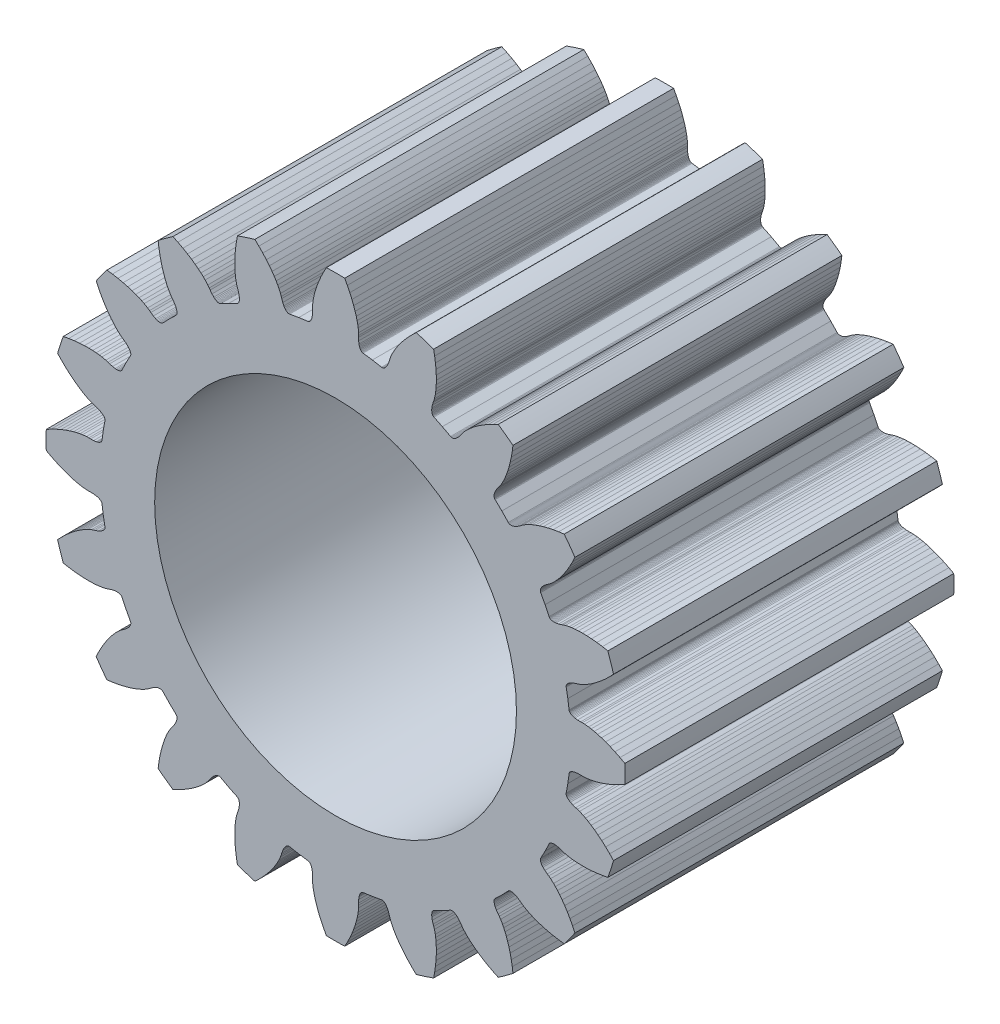
from build123d import *

# Parameters (mm, degrees)
MODEL_R             = 5.5
BOSS_EXTRUDE1_DEPTH = 10


with BuildPart() as part:
    # Model → Boss-Extrude1 (new body)
    with BuildSketch(Plane.XY):
        with BuildLine():
            Line((8.2121244, 2.2123672), (8.3351722, 2.3318876))
            Line((8.3351722, 2.3318876), (8.450961336, 2.453780018))
            ThreePointArc((8.450961336, 2.453780018), (8.369285341, 2.719345705), (8.279267036, 2.982200812))
            Line((8.279267036, 2.982200812), (8.1139451, 3.0127546))
            Line((8.1139451, 3.0127546), (7.944145, 3.037123))
            Line((7.944145, 3.037123), (7.7837495, 3.0533203))
            Line((7.7837495, 3.0533203), (7.6379915, 3.0618918))
            Line((7.6379915, 3.0618918), (7.5028672, 3.0641531))
            Line((7.5028672, 3.0641531), (7.3833956, 3.0611352))
            Line((7.3833956, 3.0611352), (7.2776713, 3.054067))
            Line((7.2776713, 3.054067), (7.1825669, 3.0436894))
            Line((7.1825669, 3.0436894), (7.1037669, 3.0317316))
            Line((7.1037669, 3.0317316), (6.9853901, 3.0064547))
            Line((6.9853901, 3.0064547), (6.9168974, 2.9858319))
            Line((6.9168974, 2.9858319), (6.8682247, 2.9676986))
            Line((6.8682247, 2.9676986), (6.7797007, 2.9411903))
            Line((6.7797007, 2.9411903), (6.7013706, 2.9268345))
            Line((6.7013706, 2.9268345), (6.6662943, 2.923934))
            Line((6.6662943, 2.923934), (6.6340777, 2.9237252))
            Line((6.6340777, 2.9237252), (6.6048156, 2.9260881))
            Line((6.6048156, 2.9260881), (6.5785985, 2.930889))
            Line((6.5785985, 2.930889), (6.5555257, 2.9380215))
            Line((6.5555257, 2.9380215), (6.5356652, 2.9473296))
            Line((6.5356652, 2.9473296), (6.5191075, 2.9587021))
            Line((6.5191075, 2.9587021), (6.5059252, 2.9719965))
            Line((6.5059252, 2.9719965), (6.4943089, 2.9910943))
            Line((6.4943089, 2.9910943), (6.3706966, 3.2460321))
            Line((6.3706966, 3.2460321), (6.2371051, 3.4958851))
            Line((6.2371051, 3.4958851), (6.2284826, 3.5165084))
            Line((6.2284826, 3.5165084), (6.2254756, 3.5349873))
            Line((6.2254756, 3.5349873), (6.2260074, 3.5550674))
            Line((6.2260074, 3.5550674), (6.2301507, 3.5766059))
            Line((6.2301507, 3.5766059), (6.2379422, 3.5994647))
            Line((6.2379422, 3.5994647), (6.2494682, 3.6234967))
            Line((6.2494682, 3.6234967), (6.2647564, 3.648559))
            Line((6.2647564, 3.648559), (6.2838618, 3.6745001))
            Line((6.2838618, 3.6745001), (6.3068257, 3.7011726))
            Line((6.3068257, 3.7011726), (6.364481, 3.7561048))
            Line((6.364481, 3.7561048), (6.4379598, 3.8121411))
            Line((6.4379598, 3.8121411), (6.481239, 3.8408596))
            Line((6.481239, 3.8408596), (6.5381822, 3.8841496))
            Line((6.5381822, 3.8841496), (6.6282118, 3.965061))
            Line((6.6282118, 3.965061), (6.6842033, 4.0217829))
            Line((6.6842033, 4.0217829), (6.7485, 4.0926242))
            Line((6.7485, 4.0926242), (6.8163615, 4.1740024))
            Line((6.8163615, 4.1740024), (6.8890266, 4.268883))
            Line((6.8890266, 4.268883), (6.9666212, 4.3795301))
            Line((6.9666212, 4.3795301), (7.0453612, 4.502489))
            Line((7.0453612, 4.502489), (7.1265354, 4.6417722))
            Line((7.1265354, 4.6417722), (7.2066269, 4.7934668))
            Line((7.2066269, 4.7934668), (7.27908211, 4.945174101))
            ThreePointArc((7.27908211, 4.945174101), (7.119339371, 5.17250287), (6.952500105, 5.39467571))
            Line((6.952500105, 5.39467571), (6.785828, 5.3726468))
            Line((6.785828, 5.3726468), (6.6168083, 5.3433514))
            Line((6.6168083, 5.3433514), (6.4592578, 5.3091911))
            Line((6.4592578, 5.3091911), (6.3179849, 5.2723013))
            Line((6.3179849, 5.2723013), (6.1887753, 5.2326962))
            Line((6.1887753, 5.2326962), (6.0760837, 5.1929073))
            Line((6.0760837, 5.1929073), (5.9777181, 5.1535144))
            Line((5.9777181, 5.1535144), (5.8904753, 5.1142559))
            Line((5.8904753, 5.1142559), (5.8192272, 5.0785328))
            Line((5.8192272, 5.0785328), (5.7144552, 5.0179126))
            Line((5.7144552, 5.0179126), (5.6556875, 4.9771337))
            Line((5.6556875, 4.9771337), (5.6150006, 4.9448472))
            Line((5.6150006, 4.9448472), (5.5390008, 4.8922809))
            Line((5.5390008, 4.8922809), (5.4689406, 4.8544224))
            Line((5.4689406, 4.8544224), (5.4364774, 4.8408247))
            Line((5.4364774, 4.8408247), (5.4059021, 4.8306707))
            Line((5.4059021, 4.8306707), (5.377342, 4.8238754))
            Line((5.377342, 4.8238754), (5.3509245, 4.8203399))
            Line((5.3509245, 4.8203399), (5.3267768, 4.8199934))
            Line((5.3267768, 4.8199934), (5.3050121, 4.8227087))
            Line((5.3050121, 4.8227087), (5.2857505, 4.8284079))
            Line((5.2857505, 4.8284079), (5.2691052, 4.8369781))
            Line((5.2691052, 4.8369781), (5.2521558, 4.8515515))
            Line((5.2521558, 4.8515515), (5.0558135, 5.0558135))
            Line((5.0558135, 5.0558135), (4.8515515, 5.2521558))
            Line((4.8515515, 5.2521558), (4.8369781, 5.2691052))
            Line((4.8369781, 5.2691052), (4.8284079, 5.2857505))
            Line((4.8284079, 5.2857505), (4.8227087, 5.3050121))
            Line((4.8227087, 5.3050121), (4.8199934, 5.3267768))
            Line((4.8199934, 5.3267768), (4.8203399, 5.3509245))
            Line((4.8203399, 5.3509245), (4.8238754, 5.377342))
            Line((4.8238754, 5.377342), (4.8306707, 5.4059021))
            Line((4.8306707, 5.4059021), (4.8408247, 5.4364774))
            Line((4.8408247, 5.4364774), (4.8544224, 5.4689406))
            Line((4.8544224, 5.4689406), (4.8922809, 5.5390008))
            Line((4.8922809, 5.5390008), (4.9448472, 5.6150006))
            Line((4.9448472, 5.6150006), (4.9771337, 5.6556875))
            Line((4.9771337, 5.6556875), (5.0179126, 5.7144552))
            Line((5.0179126, 5.7144552), (5.0785328, 5.8192272))
            Line((5.0785328, 5.8192272), (5.1142559, 5.8904753))
            Line((5.1142559, 5.8904753), (5.1535144, 5.9777181))
            Line((5.1535144, 5.9777181), (5.1929073, 6.0760837))
            Line((5.1929073, 6.0760837), (5.2326962, 6.1887753))
            Line((5.2326962, 6.1887753), (5.2723013, 6.3179849))
            Line((5.2723013, 6.3179849), (5.3091911, 6.4592578))
            Line((5.3091911, 6.4592578), (5.3433514, 6.6168083))
            Line((5.3433514, 6.6168083), (5.3726468, 6.785828))
            Line((5.3726468, 6.785828), (5.39467561, 6.952500105))
            ThreePointArc((5.39467561, 6.952500105), (5.172502846, 7.119339476), (4.945174001, 7.27908211))
            Line((4.945174001, 7.27908211), (4.7934668, 7.2066269))
            Line((4.7934668, 7.2066269), (4.6417722, 7.1265354))
            Line((4.6417722, 7.1265354), (4.502489, 7.0453612))
            Line((4.502489, 7.0453612), (4.3795301, 6.9666212))
            Line((4.3795301, 6.9666212), (4.268883, 6.8890266))
            Line((4.268883, 6.8890266), (4.1740024, 6.8163615))
            Line((4.1740024, 6.8163615), (4.0926242, 6.7485))
            Line((4.0926242, 6.7485), (4.0217829, 6.6842033))
            Line((4.0217829, 6.6842033), (3.965061, 6.6282118))
            Line((3.965061, 6.6282118), (3.8841496, 6.5381822))
            Line((3.8841496, 6.5381822), (3.8408596, 6.481239))
            Line((3.8408596, 6.481239), (3.8121411, 6.4379598))
            Line((3.8121411, 6.4379598), (3.7561048, 6.364481))
            Line((3.7561048, 6.364481), (3.7011726, 6.3068257))
            Line((3.7011726, 6.3068257), (3.6745001, 6.2838618))
            Line((3.6745001, 6.2838618), (3.648559, 6.2647564))
            Line((3.648559, 6.2647564), (3.6234967, 6.2494682))
            Line((3.6234967, 6.2494682), (3.5994647, 6.2379422))
            Line((3.5994647, 6.2379422), (3.5766059, 6.2301507))
            Line((3.5766059, 6.2301507), (3.5550674, 6.2260074))
            Line((3.5550674, 6.2260074), (3.5349873, 6.2254756))
            Line((3.5349873, 6.2254756), (3.5165084, 6.2284826))
            Line((3.5165084, 6.2284826), (3.4958851, 6.2371051))
            Line((3.4958851, 6.2371051), (3.2460321, 6.3706966))
            Line((3.2460321, 6.3706966), (2.9910943, 6.4943089))
            Line((2.9910943, 6.4943089), (2.9719965, 6.5059252))
            Line((2.9719965, 6.5059252), (2.9587021, 6.5191075))
            Line((2.9587021, 6.5191075), (2.9473296, 6.5356652))
            Line((2.9473296, 6.5356652), (2.9380215, 6.5555257))
            Line((2.9380215, 6.5555257), (2.930889, 6.5785985))
            Line((2.930889, 6.5785985), (2.9260881, 6.6048156))
            Line((2.9260881, 6.6048156), (2.9237252, 6.6340777))
            Line((2.9237252, 6.6340777), (2.923934, 6.6662943))
            Line((2.923934, 6.6662943), (2.9268345, 6.7013706))
            Line((2.9268345, 6.7013706), (2.9411903, 6.7797007))
            Line((2.9411903, 6.7797007), (2.9676986, 6.8682247))
            Line((2.9676986, 6.8682247), (2.9858319, 6.9168974))
            Line((2.9858319, 6.9168974), (3.0064547, 6.9853901))
            Line((3.0064547, 6.9853901), (3.0317316, 7.1037669))
            Line((3.0317316, 7.1037669), (3.0436894, 7.1825669))
            Line((3.0436894, 7.1825669), (3.054067, 7.2776713))
            Line((3.054067, 7.2776713), (3.0611352, 7.3833956))
            Line((3.0611352, 7.3833956), (3.0641531, 7.5028672))
            Line((3.0641531, 7.5028672), (3.0618918, 7.6379915))
            Line((3.0618918, 7.6379915), (3.0533203, 7.7837495))
            Line((3.0533203, 7.7837495), (3.037123, 7.944145))
            Line((3.037123, 7.944145), (3.0127546, 8.1139451))
            Line((3.0127546, 8.1139451), (2.982200712, 8.279267036))
            ThreePointArc((2.982200712, 8.279267036), (2.719345707, 8.369285655), (2.453779918, 8.450961336))
            Line((2.453779918, 8.450961336), (2.3318876, 8.3351722))
            Line((2.3318876, 8.3351722), (2.2123672, 8.2121244))
            Line((2.2123672, 8.2121244), (2.1049851, 8.0918823))
            Line((2.1049851, 8.0918823), (2.0123762, 7.9789997))
            Line((2.0123762, 7.9789997), (1.9311227, 7.8710111))
            Line((1.9311227, 7.8710111), (1.8633406, 7.7725827))
            Line((1.8633406, 7.7725827), (1.8069157, 7.6828953))
            Line((1.8069157, 7.6828953), (1.7594104, 7.5998544))
            Line((1.7594104, 7.5998544), (1.722767, 7.5290753))
            Line((1.722767, 7.5290753), (1.6736363, 7.418449))
            Line((1.6736363, 7.418449), (1.6500615, 7.3509155))
            Line((1.6500615, 7.3509155), (1.6361226, 7.30088))
            Line((1.6361226, 7.30088), (1.6055352, 7.2136814))
            Line((1.6055352, 7.2136814), (1.571108, 7.1418729))
            Line((1.571108, 7.1418729), (1.5528372, 7.1117907))
            Line((1.5528372, 7.1117907), (1.5340696, 7.0856042))
            Line((1.5340696, 7.0856042), (1.5149583, 7.0633195))
            Line((1.5149583, 7.0633195), (1.4956642, 7.0449314))
            Line((1.4956642, 7.0449314), (1.4763319, 7.0304574))
            Line((1.4763319, 7.0304574), (1.4571279, 7.0198611))
            Line((1.4571279, 7.0198611), (1.438195, 7.0131503))
            Line((1.438195, 7.0131503), (1.4196913, 7.0102998))
            Line((1.4196913, 7.0102998), (1.3974129, 7.0121274))
            Line((1.3974129, 7.0121274), (1.1185064, 7.0619716))
            Line((1.1185064, 7.0619716), (0.8378479, 7.1007538))
            Line((0.8378479, 7.1007538), (0.8160952, 7.1059))
            Line((0.8160952, 7.1059), (0.7993779, 7.1143289))
            Line((0.7993779, 7.1143289), (0.7834454, 7.1265619))
            Line((0.7834454, 7.1265619), (0.7684557, 7.142574))
            Line((0.7684557, 7.142574), (0.7545424, 7.1623135))
            Line((0.7545424, 7.1623135), (0.7418748, 7.1857639))
            Line((0.7418748, 7.1857639), (0.7305852, 7.2128636))
            Line((0.7305852, 7.2128636), (0.7208283, 7.243568))
            Line((0.7208283, 7.243568), (0.7127476, 7.2778238))
            Line((0.7127476, 7.2778238), (0.7021954, 7.3567563))
            Line((0.7021954, 7.3567563), (0.7000509, 7.4491392))
            Line((0.7000509, 7.4491392), (0.702256, 7.5010331))
            Line((0.702256, 7.5010331), (0.7007041, 7.5725463))
            Line((0.7007041, 7.5725463), (0.6881634, 7.6929404))
            Line((0.6881634, 7.6929404), (0.6751854, 7.7715788))
            Line((0.6751854, 7.7715788), (0.6556662, 7.8652353))
            Line((0.6556662, 7.8652353), (0.6297179, 7.9679693))
            Line((0.6297179, 7.9679693), (0.5956693, 8.0825261))
            Line((0.5956693, 8.0825261), (0.551763, 8.2103381))
            Line((0.551763, 8.2103381), (0.4985693, 8.3463135))
            Line((0.4985693, 8.3463135), (0.4335998, 8.4938535))
            Line((0.4335998, 8.4938535), (0.357953, 8.6478127))
            Line((0.357953, 8.6478127), (0.277807302, 8.795601456))
            ThreePointArc((0.277807302, 8.795601456), (0, 8.799987383), (-0.277807302, 8.795601456))
            Line((-0.277807302, 8.795601456), (-0.357953, 8.6478127))
            Line((-0.357953, 8.6478127), (-0.4335998, 8.4938535))
            Line((-0.4335998, 8.4938535), (-0.4985693, 8.3463135))
            Line((-0.4985693, 8.3463135), (-0.551763, 8.2103381))
            Line((-0.551763, 8.2103381), (-0.5956693, 8.0825261))
            Line((-0.5956693, 8.0825261), (-0.6297179, 7.9679693))
            Line((-0.6297179, 7.9679693), (-0.6556662, 7.8652353))
            Line((-0.6556662, 7.8652353), (-0.6751854, 7.7715788))
            Line((-0.6751854, 7.7715788), (-0.6881634, 7.6929404))
            Line((-0.6881634, 7.6929404), (-0.7007041, 7.5725463))
            Line((-0.7007041, 7.5725463), (-0.702256, 7.5010331))
            Line((-0.702256, 7.5010331), (-0.7000509, 7.4491392))
            Line((-0.7000509, 7.4491392), (-0.7021954, 7.3567563))
            Line((-0.7021954, 7.3567563), (-0.7127476, 7.2778238))
            Line((-0.7127476, 7.2778238), (-0.7208283, 7.243568))
            Line((-0.7208283, 7.243568), (-0.7305852, 7.2128636))
            Line((-0.7305852, 7.2128636), (-0.7418748, 7.1857639))
            Line((-0.7418748, 7.1857639), (-0.7545424, 7.1623135))
            Line((-0.7545424, 7.1623135), (-0.7684557, 7.142574))
            Line((-0.7684557, 7.142574), (-0.7834454, 7.1265619))
            Line((-0.7834454, 7.1265619), (-0.7993779, 7.1143289))
            Line((-0.7993779, 7.1143289), (-0.8160952, 7.1059))
            Line((-0.8160952, 7.1059), (-0.8378479, 7.1007538))
            Line((-0.8378479, 7.1007538), (-1.1185064, 7.0619716))
            Line((-1.1185064, 7.0619716), (-1.3974129, 7.0121274))
            Line((-1.3974129, 7.0121274), (-1.4196913, 7.0102998))
            Line((-1.4196913, 7.0102998), (-1.438195, 7.0131503))
            Line((-1.438195, 7.0131503), (-1.4571279, 7.0198611))
            Line((-1.4571279, 7.0198611), (-1.4763319, 7.0304574))
            Line((-1.4763319, 7.0304574), (-1.4956642, 7.0449314))
            Line((-1.4956642, 7.0449314), (-1.5149583, 7.0633195))
            Line((-1.5149583, 7.0633195), (-1.5340696, 7.0856042))
            Line((-1.5340696, 7.0856042), (-1.5528372, 7.1117907))
            Line((-1.5528372, 7.1117907), (-1.571108, 7.1418729))
            Line((-1.571108, 7.1418729), (-1.6055352, 7.2136814))
            Line((-1.6055352, 7.2136814), (-1.6361226, 7.30088))
            Line((-1.6361226, 7.30088), (-1.6500615, 7.3509155))
            Line((-1.6500615, 7.3509155), (-1.6736363, 7.418449))
            Line((-1.6736363, 7.418449), (-1.722767, 7.5290753))
            Line((-1.722767, 7.5290753), (-1.7594104, 7.5998544))
            Line((-1.7594104, 7.5998544), (-1.8069157, 7.6828953))
            Line((-1.8069157, 7.6828953), (-1.8633406, 7.7725827))
            Line((-1.8633406, 7.7725827), (-1.9311227, 7.8710111))
            Line((-1.9311227, 7.8710111), (-2.0123762, 7.9789997))
            Line((-2.0123762, 7.9789997), (-2.1049851, 8.0918823))
            Line((-2.1049851, 8.0918823), (-2.2123672, 8.2121244))
            Line((-2.2123672, 8.2121244), (-2.3318876, 8.3351722))
            Line((-2.3318876, 8.3351722), (-2.453780018, 8.450961336))
            ThreePointArc((-2.453780018, 8.450961336), (-2.71934577, 8.36928554), (-2.982200812, 8.279267036))
            Line((-2.982200812, 8.279267036), (-3.0127546, 8.1139451))
            Line((-3.0127546, 8.1139451), (-3.037123, 7.944145))
            Line((-3.037123, 7.944145), (-3.0533203, 7.7837495))
            Line((-3.0533203, 7.7837495), (-3.0618918, 7.6379915))
            Line((-3.0618918, 7.6379915), (-3.0641531, 7.5028672))
            Line((-3.0641531, 7.5028672), (-3.0611352, 7.3833956))
            Line((-3.0611352, 7.3833956), (-3.054067, 7.2776713))
            Line((-3.054067, 7.2776713), (-3.0436894, 7.1825669))
            Line((-3.0436894, 7.1825669), (-3.0317316, 7.1037669))
            Line((-3.0317316, 7.1037669), (-3.0064547, 6.9853901))
            Line((-3.0064547, 6.9853901), (-2.9858319, 6.9168974))
            Line((-2.9858319, 6.9168974), (-2.9676986, 6.8682247))
            Line((-2.9676986, 6.8682247), (-2.9411903, 6.7797007))
            Line((-2.9411903, 6.7797007), (-2.9268345, 6.7013706))
            Line((-2.9268345, 6.7013706), (-2.923934, 6.6662943))
            Line((-2.923934, 6.6662943), (-2.9237252, 6.6340777))
            Line((-2.9237252, 6.6340777), (-2.9260881, 6.6048156))
            Line((-2.9260881, 6.6048156), (-2.930889, 6.5785985))
            Line((-2.930889, 6.5785985), (-2.9380215, 6.5555257))
            Line((-2.9380215, 6.5555257), (-2.9473296, 6.5356652))
            Line((-2.9473296, 6.5356652), (-2.9587021, 6.5191075))
            Line((-2.9587021, 6.5191075), (-2.9719965, 6.5059252))
            Line((-2.9719965, 6.5059252), (-2.9910943, 6.4943089))
            Line((-2.9910943, 6.4943089), (-3.2460321, 6.3706966))
            Line((-3.2460321, 6.3706966), (-3.4958851, 6.2371051))
            Line((-3.4958851, 6.2371051), (-3.5165084, 6.2284826))
            Line((-3.5165084, 6.2284826), (-3.5349873, 6.2254756))
            Line((-3.5349873, 6.2254756), (-3.5550674, 6.2260074))
            Line((-3.5550674, 6.2260074), (-3.5766059, 6.2301507))
            Line((-3.5766059, 6.2301507), (-3.5994647, 6.2379422))
            Line((-3.5994647, 6.2379422), (-3.6234967, 6.2494682))
            Line((-3.6234967, 6.2494682), (-3.648559, 6.2647564))
            Line((-3.648559, 6.2647564), (-3.6745001, 6.2838618))
            Line((-3.6745001, 6.2838618), (-3.7011726, 6.3068257))
            Line((-3.7011726, 6.3068257), (-3.7561048, 6.364481))
            Line((-3.7561048, 6.364481), (-3.8121411, 6.4379598))
            Line((-3.8121411, 6.4379598), (-3.8408596, 6.481239))
            Line((-3.8408596, 6.481239), (-3.8841496, 6.5381822))
            Line((-3.8841496, 6.5381822), (-3.965061, 6.6282118))
            Line((-3.965061, 6.6282118), (-4.0217829, 6.6842033))
            Line((-4.0217829, 6.6842033), (-4.0926242, 6.7485))
            Line((-4.0926242, 6.7485), (-4.1740024, 6.8163615))
            Line((-4.1740024, 6.8163615), (-4.268883, 6.8890266))
            Line((-4.268883, 6.8890266), (-4.3795301, 6.9666212))
            Line((-4.3795301, 6.9666212), (-4.502489, 7.0453612))
            Line((-4.502489, 7.0453612), (-4.6417722, 7.1265354))
            Line((-4.6417722, 7.1265354), (-4.7934668, 7.2066269))
            Line((-4.7934668, 7.2066269), (-4.945174101, 7.27908211))
            ThreePointArc((-4.945174101, 7.27908211), (-5.172503016, 7.119339572), (-5.39467571, 6.952500105))
            Line((-5.39467571, 6.952500105), (-5.3726468, 6.785828))
            Line((-5.3726468, 6.785828), (-5.3433514, 6.6168083))
            Line((-5.3433514, 6.6168083), (-5.3091911, 6.4592578))
            Line((-5.3091911, 6.4592578), (-5.2723013, 6.3179849))
            Line((-5.2723013, 6.3179849), (-5.2326962, 6.1887753))
            Line((-5.2326962, 6.1887753), (-5.1929073, 6.0760837))
            Line((-5.1929073, 6.0760837), (-5.1535144, 5.9777181))
            Line((-5.1535144, 5.9777181), (-5.1142559, 5.8904753))
            Line((-5.1142559, 5.8904753), (-5.0785328, 5.8192272))
            Line((-5.0785328, 5.8192272), (-5.0179126, 5.7144552))
            Line((-5.0179126, 5.7144552), (-4.9771337, 5.6556875))
            Line((-4.9771337, 5.6556875), (-4.9448472, 5.6150006))
            Line((-4.9448472, 5.6150006), (-4.8922809, 5.5390008))
            Line((-4.8922809, 5.5390008), (-4.8544224, 5.4689406))
            Line((-4.8544224, 5.4689406), (-4.8408247, 5.4364774))
            Line((-4.8408247, 5.4364774), (-4.8306707, 5.4059021))
            Line((-4.8306707, 5.4059021), (-4.8238754, 5.377342))
            Line((-4.8238754, 5.377342), (-4.8203399, 5.3509245))
            Line((-4.8203399, 5.3509245), (-4.8199934, 5.3267768))
            Line((-4.8199934, 5.3267768), (-4.8227087, 5.3050121))
            Line((-4.8227087, 5.3050121), (-4.8284079, 5.2857505))
            Line((-4.8284079, 5.2857505), (-4.8369781, 5.2691052))
            Line((-4.8369781, 5.2691052), (-4.8515515, 5.2521558))
            Line((-4.8515515, 5.2521558), (-5.0558135, 5.0558135))
            Line((-5.0558135, 5.0558135), (-5.2521558, 4.8515515))
            Line((-5.2521558, 4.8515515), (-5.2691052, 4.8369781))
            Line((-5.2691052, 4.8369781), (-5.2857505, 4.8284079))
            Line((-5.2857505, 4.8284079), (-5.3050121, 4.8227087))
            Line((-5.3050121, 4.8227087), (-5.3267768, 4.8199934))
            Line((-5.3267768, 4.8199934), (-5.3509245, 4.8203399))
            Line((-5.3509245, 4.8203399), (-5.377342, 4.8238754))
            Line((-5.377342, 4.8238754), (-5.4059021, 4.8306707))
            Line((-5.4059021, 4.8306707), (-5.4364774, 4.8408247))
            Line((-5.4364774, 4.8408247), (-5.4689406, 4.8544224))
            Line((-5.4689406, 4.8544224), (-5.5390008, 4.8922809))
            Line((-5.5390008, 4.8922809), (-5.6150006, 4.9448472))
            Line((-5.6150006, 4.9448472), (-5.6556875, 4.9771337))
            Line((-5.6556875, 4.9771337), (-5.7144552, 5.0179126))
            Line((-5.7144552, 5.0179126), (-5.8192272, 5.0785328))
            Line((-5.8192272, 5.0785328), (-5.8904753, 5.1142559))
            Line((-5.8904753, 5.1142559), (-5.9777181, 5.1535144))
            Line((-5.9777181, 5.1535144), (-6.0760837, 5.1929073))
            Line((-6.0760837, 5.1929073), (-6.1887753, 5.2326962))
            Line((-6.1887753, 5.2326962), (-6.3179849, 5.2723013))
            Line((-6.3179849, 5.2723013), (-6.4592578, 5.3091911))
            Line((-6.4592578, 5.3091911), (-6.6168083, 5.3433514))
            Line((-6.6168083, 5.3433514), (-6.785828, 5.3726468))
            Line((-6.785828, 5.3726468), (-6.952500105, 5.39467561))
            ThreePointArc((-6.952500105, 5.39467561), (-7.119339395, 5.172502787), (-7.27908211, 4.945174001))
            Line((-7.27908211, 4.945174001), (-7.2066269, 4.7934668))
            Line((-7.2066269, 4.7934668), (-7.1265354, 4.6417722))
            Line((-7.1265354, 4.6417722), (-7.0453612, 4.502489))
            Line((-7.0453612, 4.502489), (-6.9666212, 4.3795301))
            Line((-6.9666212, 4.3795301), (-6.8890266, 4.268883))
            Line((-6.8890266, 4.268883), (-6.8163615, 4.1740024))
            Line((-6.8163615, 4.1740024), (-6.7485, 4.0926242))
            Line((-6.7485, 4.0926242), (-6.6842033, 4.0217829))
            Line((-6.6842033, 4.0217829), (-6.6282118, 3.965061))
            Line((-6.6282118, 3.965061), (-6.5381822, 3.8841496))
            Line((-6.5381822, 3.8841496), (-6.481239, 3.8408596))
            Line((-6.481239, 3.8408596), (-6.4379598, 3.8121411))
            Line((-6.4379598, 3.8121411), (-6.364481, 3.7561048))
            Line((-6.364481, 3.7561048), (-6.3068257, 3.7011726))
            Line((-6.3068257, 3.7011726), (-6.2838618, 3.6745001))
            Line((-6.2838618, 3.6745001), (-6.2647564, 3.648559))
            Line((-6.2647564, 3.648559), (-6.2494682, 3.6234967))
            Line((-6.2494682, 3.6234967), (-6.2379422, 3.5994647))
            Line((-6.2379422, 3.5994647), (-6.2301507, 3.5766059))
            Line((-6.2301507, 3.5766059), (-6.2260074, 3.5550674))
            Line((-6.2260074, 3.5550674), (-6.2254756, 3.5349873))
            Line((-6.2254756, 3.5349873), (-6.2284826, 3.5165084))
            Line((-6.2284826, 3.5165084), (-6.2371051, 3.4958851))
            Line((-6.2371051, 3.4958851), (-6.3706966, 3.2460321))
            Line((-6.3706966, 3.2460321), (-6.4943089, 2.9910943))
            Line((-6.4943089, 2.9910943), (-6.5059252, 2.9719965))
            Line((-6.5059252, 2.9719965), (-6.5191075, 2.9587021))
            Line((-6.5191075, 2.9587021), (-6.5356652, 2.9473296))
            Line((-6.5356652, 2.9473296), (-6.5555257, 2.9380215))
            Line((-6.5555257, 2.9380215), (-6.5785985, 2.930889))
            Line((-6.5785985, 2.930889), (-6.6048156, 2.9260881))
            Line((-6.6048156, 2.9260881), (-6.6340777, 2.9237252))
            Line((-6.6340777, 2.9237252), (-6.6662943, 2.923934))
            Line((-6.6662943, 2.923934), (-6.7013706, 2.9268345))
            Line((-6.7013706, 2.9268345), (-6.7797007, 2.9411903))
            Line((-6.7797007, 2.9411903), (-6.8682247, 2.9676986))
            Line((-6.8682247, 2.9676986), (-6.9168974, 2.9858319))
            Line((-6.9168974, 2.9858319), (-6.9853901, 3.0064547))
            Line((-6.9853901, 3.0064547), (-7.1037669, 3.0317316))
            Line((-7.1037669, 3.0317316), (-7.1825669, 3.0436894))
            Line((-7.1825669, 3.0436894), (-7.2776713, 3.054067))
            Line((-7.2776713, 3.054067), (-7.3833956, 3.0611352))
            Line((-7.3833956, 3.0611352), (-7.5028672, 3.0641531))
            Line((-7.5028672, 3.0641531), (-7.6379915, 3.0618918))
            Line((-7.6379915, 3.0618918), (-7.7837495, 3.0533203))
            Line((-7.7837495, 3.0533203), (-7.944145, 3.037123))
            Line((-7.944145, 3.037123), (-8.1139451, 3.0127546))
            Line((-8.1139451, 3.0127546), (-8.279267036, 2.982200712))
            ThreePointArc((-8.279267036, 2.982200712), (-8.36928555, 2.719345673), (-8.450961336, 2.453779918))
            Line((-8.450961336, 2.453779918), (-8.3351722, 2.3318876))
            Line((-8.3351722, 2.3318876), (-8.2121244, 2.2123672))
            Line((-8.2121244, 2.2123672), (-8.0918823, 2.1049851))
            Line((-8.0918823, 2.1049851), (-7.9789997, 2.0123762))
            Line((-7.9789997, 2.0123762), (-7.8710111, 1.9311227))
            Line((-7.8710111, 1.9311227), (-7.7725827, 1.8633406))
            Line((-7.7725827, 1.8633406), (-7.6828953, 1.8069157))
            Line((-7.6828953, 1.8069157), (-7.5998544, 1.7594104))
            Line((-7.5998544, 1.7594104), (-7.5290753, 1.722767))
            Line((-7.5290753, 1.722767), (-7.418449, 1.6736363))
            Line((-7.418449, 1.6736363), (-7.3509155, 1.6500615))
            Line((-7.3509155, 1.6500615), (-7.30088, 1.6361226))
            Line((-7.30088, 1.6361226), (-7.2136814, 1.6055352))
            Line((-7.2136814, 1.6055352), (-7.1418729, 1.571108))
            Line((-7.1418729, 1.571108), (-7.1117907, 1.5528372))
            Line((-7.1117907, 1.5528372), (-7.0856042, 1.5340696))
            Line((-7.0856042, 1.5340696), (-7.0633195, 1.5149583))
            Line((-7.0633195, 1.5149583), (-7.0449314, 1.4956642))
            Line((-7.0449314, 1.4956642), (-7.0304574, 1.4763319))
            Line((-7.0304574, 1.4763319), (-7.0198611, 1.4571279))
            Line((-7.0198611, 1.4571279), (-7.0131503, 1.438195))
            Line((-7.0131503, 1.438195), (-7.0102998, 1.4196913))
            Line((-7.0102998, 1.4196913), (-7.0121274, 1.3974129))
            Line((-7.0121274, 1.3974129), (-7.0619716, 1.1185064))
            Line((-7.0619716, 1.1185064), (-7.1007538, 0.8378479))
            Line((-7.1007538, 0.8378479), (-7.1059, 0.8160952))
            Line((-7.1059, 0.8160952), (-7.1143289, 0.7993779))
            Line((-7.1143289, 0.7993779), (-7.1265619, 0.7834454))
            Line((-7.1265619, 0.7834454), (-7.142574, 0.7684557))
            Line((-7.142574, 0.7684557), (-7.1623135, 0.7545424))
            Line((-7.1623135, 0.7545424), (-7.1857639, 0.7418748))
            Line((-7.1857639, 0.7418748), (-7.2128636, 0.7305852))
            Line((-7.2128636, 0.7305852), (-7.243568, 0.7208283))
            Line((-7.243568, 0.7208283), (-7.2778238, 0.7127476))
            Line((-7.2778238, 0.7127476), (-7.3567563, 0.7021954))
            Line((-7.3567563, 0.7021954), (-7.4491392, 0.7000509))
            Line((-7.4491392, 0.7000509), (-7.5010331, 0.702256))
            Line((-7.5010331, 0.702256), (-7.5725463, 0.7007041))
            Line((-7.5725463, 0.7007041), (-7.6929404, 0.6881634))
            Line((-7.6929404, 0.6881634), (-7.7715788, 0.6751854))
            Line((-7.7715788, 0.6751854), (-7.8652353, 0.6556662))
            Line((-7.8652353, 0.6556662), (-7.9679693, 0.6297179))
            Line((-7.9679693, 0.6297179), (-8.0825261, 0.5956693))
            Line((-8.0825261, 0.5956693), (-8.2103381, 0.551763))
            Line((-8.2103381, 0.551763), (-8.3463135, 0.4985693))
            Line((-8.3463135, 0.4985693), (-8.4938535, 0.4335998))
            Line((-8.4938535, 0.4335998), (-8.6478127, 0.357953))
            Line((-8.6478127, 0.357953), (-8.795601456, 0.277807302))
            ThreePointArc((-8.795601456, 0.277807302), (-8.7999876, 0), (-8.795601456, -0.277807302))
            Line((-8.795601456, -0.277807302), (-8.6478127, -0.357953))
            Line((-8.6478127, -0.357953), (-8.4938535, -0.4335998))
            Line((-8.4938535, -0.4335998), (-8.3463135, -0.4985693))
            Line((-8.3463135, -0.4985693), (-8.2103381, -0.551763))
            Line((-8.2103381, -0.551763), (-8.0825261, -0.5956693))
            Line((-8.0825261, -0.5956693), (-7.9679693, -0.6297179))
            Line((-7.9679693, -0.6297179), (-7.8652353, -0.6556662))
            Line((-7.8652353, -0.6556662), (-7.7715788, -0.6751854))
            Line((-7.7715788, -0.6751854), (-7.6929404, -0.6881634))
            Line((-7.6929404, -0.6881634), (-7.5725463, -0.7007041))
            Line((-7.5725463, -0.7007041), (-7.5010331, -0.702256))
            Line((-7.5010331, -0.702256), (-7.4491392, -0.7000509))
            Line((-7.4491392, -0.7000509), (-7.3567563, -0.7021954))
            Line((-7.3567563, -0.7021954), (-7.2778238, -0.7127476))
            Line((-7.2778238, -0.7127476), (-7.243568, -0.7208283))
            Line((-7.243568, -0.7208283), (-7.2128636, -0.7305852))
            Line((-7.2128636, -0.7305852), (-7.1857639, -0.7418748))
            Line((-7.1857639, -0.7418748), (-7.1623135, -0.7545424))
            Line((-7.1623135, -0.7545424), (-7.142574, -0.7684557))
            Line((-7.142574, -0.7684557), (-7.1265619, -0.7834454))
            Line((-7.1265619, -0.7834454), (-7.1143289, -0.7993779))
            Line((-7.1143289, -0.7993779), (-7.1059, -0.8160952))
            Line((-7.1059, -0.8160952), (-7.1007538, -0.8378479))
            Line((-7.1007538, -0.8378479), (-7.0619716, -1.1185064))
            Line((-7.0619716, -1.1185064), (-7.0121274, -1.3974129))
            Line((-7.0121274, -1.3974129), (-7.0102998, -1.4196913))
            Line((-7.0102998, -1.4196913), (-7.0131503, -1.438195))
            Line((-7.0131503, -1.438195), (-7.0198611, -1.4571279))
            Line((-7.0198611, -1.4571279), (-7.0304574, -1.4763319))
            Line((-7.0304574, -1.4763319), (-7.0449314, -1.4956642))
            Line((-7.0449314, -1.4956642), (-7.0633195, -1.5149583))
            Line((-7.0633195, -1.5149583), (-7.0856042, -1.5340696))
            Line((-7.0856042, -1.5340696), (-7.1117907, -1.5528372))
            Line((-7.1117907, -1.5528372), (-7.1418729, -1.571108))
            Line((-7.1418729, -1.571108), (-7.2136814, -1.6055352))
            Line((-7.2136814, -1.6055352), (-7.30088, -1.6361226))
            Line((-7.30088, -1.6361226), (-7.3509155, -1.6500615))
            Line((-7.3509155, -1.6500615), (-7.418449, -1.6736363))
            Line((-7.418449, -1.6736363), (-7.5290753, -1.722767))
            Line((-7.5290753, -1.722767), (-7.5998544, -1.7594104))
            Line((-7.5998544, -1.7594104), (-7.6828953, -1.8069157))
            Line((-7.6828953, -1.8069157), (-7.7725827, -1.8633406))
            Line((-7.7725827, -1.8633406), (-7.8710111, -1.9311227))
            Line((-7.8710111, -1.9311227), (-7.9789997, -2.0123762))
            Line((-7.9789997, -2.0123762), (-8.0918823, -2.1049851))
            Line((-8.0918823, -2.1049851), (-8.2121244, -2.2123672))
            Line((-8.2121244, -2.2123672), (-8.3351722, -2.3318876))
            Line((-8.3351722, -2.3318876), (-8.450961336, -2.453780018))
            ThreePointArc((-8.450961336, -2.453780018), (-8.369285341, -2.719345705), (-8.279267036, -2.982200812))
            Line((-8.279267036, -2.982200812), (-8.1139451, -3.0127546))
            Line((-8.1139451, -3.0127546), (-7.944145, -3.037123))
            Line((-7.944145, -3.037123), (-7.7837495, -3.0533203))
            Line((-7.7837495, -3.0533203), (-7.6379915, -3.0618918))
            Line((-7.6379915, -3.0618918), (-7.5028672, -3.0641531))
            Line((-7.5028672, -3.0641531), (-7.3833956, -3.0611352))
            Line((-7.3833956, -3.0611352), (-7.2776713, -3.054067))
            Line((-7.2776713, -3.054067), (-7.1825669, -3.0436894))
            Line((-7.1825669, -3.0436894), (-7.1037669, -3.0317316))
            Line((-7.1037669, -3.0317316), (-6.9853901, -3.0064547))
            Line((-6.9853901, -3.0064547), (-6.9168974, -2.9858319))
            Line((-6.9168974, -2.9858319), (-6.8682247, -2.9676986))
            Line((-6.8682247, -2.9676986), (-6.7797007, -2.9411903))
            Line((-6.7797007, -2.9411903), (-6.7013706, -2.9268345))
            Line((-6.7013706, -2.9268345), (-6.6662943, -2.923934))
            Line((-6.6662943, -2.923934), (-6.6340777, -2.9237252))
            Line((-6.6340777, -2.9237252), (-6.6048156, -2.9260881))
            Line((-6.6048156, -2.9260881), (-6.5785985, -2.930889))
            Line((-6.5785985, -2.930889), (-6.5555257, -2.9380215))
            Line((-6.5555257, -2.9380215), (-6.5356652, -2.9473296))
            Line((-6.5356652, -2.9473296), (-6.5191075, -2.9587021))
            Line((-6.5191075, -2.9587021), (-6.5059252, -2.9719965))
            Line((-6.5059252, -2.9719965), (-6.4943089, -2.9910943))
            Line((-6.4943089, -2.9910943), (-6.3706966, -3.2460321))
            Line((-6.3706966, -3.2460321), (-6.2371051, -3.4958851))
            Line((-6.2371051, -3.4958851), (-6.2284826, -3.5165084))
            Line((-6.2284826, -3.5165084), (-6.2254756, -3.5349873))
            Line((-6.2254756, -3.5349873), (-6.2260074, -3.5550674))
            Line((-6.2260074, -3.5550674), (-6.2301507, -3.5766059))
            Line((-6.2301507, -3.5766059), (-6.2379422, -3.5994647))
            Line((-6.2379422, -3.5994647), (-6.2494682, -3.6234967))
            Line((-6.2494682, -3.6234967), (-6.2647564, -3.648559))
            Line((-6.2647564, -3.648559), (-6.2838618, -3.6745001))
            Line((-6.2838618, -3.6745001), (-6.3068257, -3.7011726))
            Line((-6.3068257, -3.7011726), (-6.364481, -3.7561048))
            Line((-6.364481, -3.7561048), (-6.4379598, -3.8121411))
            Line((-6.4379598, -3.8121411), (-6.481239, -3.8408596))
            Line((-6.481239, -3.8408596), (-6.5381822, -3.8841496))
            Line((-6.5381822, -3.8841496), (-6.6282118, -3.965061))
            Line((-6.6282118, -3.965061), (-6.6842033, -4.0217829))
            Line((-6.6842033, -4.0217829), (-6.7485, -4.0926242))
            Line((-6.7485, -4.0926242), (-6.8163615, -4.1740024))
            Line((-6.8163615, -4.1740024), (-6.8890266, -4.268883))
            Line((-6.8890266, -4.268883), (-6.9666212, -4.3795301))
            Line((-6.9666212, -4.3795301), (-7.0453612, -4.502489))
            Line((-7.0453612, -4.502489), (-7.1265354, -4.6417722))
            Line((-7.1265354, -4.6417722), (-7.2066269, -4.7934668))
            Line((-7.2066269, -4.7934668), (-7.27908211, -4.945174101))
            ThreePointArc((-7.27908211, -4.945174101), (-7.119339371, -5.17250287), (-6.952500105, -5.39467571))
            Line((-6.952500105, -5.39467571), (-6.785828, -5.3726468))
            Line((-6.785828, -5.3726468), (-6.6168083, -5.3433514))
            Line((-6.6168083, -5.3433514), (-6.4592578, -5.3091911))
            Line((-6.4592578, -5.3091911), (-6.3179849, -5.2723013))
            Line((-6.3179849, -5.2723013), (-6.1887753, -5.2326962))
            Line((-6.1887753, -5.2326962), (-6.0760837, -5.1929073))
            Line((-6.0760837, -5.1929073), (-5.9777181, -5.1535144))
            Line((-5.9777181, -5.1535144), (-5.8904753, -5.1142559))
            Line((-5.8904753, -5.1142559), (-5.8192272, -5.0785328))
            Line((-5.8192272, -5.0785328), (-5.7144552, -5.0179126))
            Line((-5.7144552, -5.0179126), (-5.6556875, -4.9771337))
            Line((-5.6556875, -4.9771337), (-5.6150006, -4.9448472))
            Line((-5.6150006, -4.9448472), (-5.5390008, -4.8922809))
            Line((-5.5390008, -4.8922809), (-5.4689406, -4.8544224))
            Line((-5.4689406, -4.8544224), (-5.4364774, -4.8408247))
            Line((-5.4364774, -4.8408247), (-5.4059021, -4.8306707))
            Line((-5.4059021, -4.8306707), (-5.377342, -4.8238754))
            Line((-5.377342, -4.8238754), (-5.3509245, -4.8203399))
            Line((-5.3509245, -4.8203399), (-5.3267768, -4.8199934))
            Line((-5.3267768, -4.8199934), (-5.3050121, -4.8227087))
            Line((-5.3050121, -4.8227087), (-5.2857505, -4.8284079))
            Line((-5.2857505, -4.8284079), (-5.2691052, -4.8369781))
            Line((-5.2691052, -4.8369781), (-5.2521558, -4.8515515))
            Line((-5.2521558, -4.8515515), (-5.0558135, -5.0558135))
            Line((-5.0558135, -5.0558135), (-4.8515515, -5.2521558))
            Line((-4.8515515, -5.2521558), (-4.8369781, -5.2691052))
            Line((-4.8369781, -5.2691052), (-4.8284079, -5.2857505))
            Line((-4.8284079, -5.2857505), (-4.8227087, -5.3050121))
            Line((-4.8227087, -5.3050121), (-4.8199934, -5.3267768))
            Line((-4.8199934, -5.3267768), (-4.8203399, -5.3509245))
            Line((-4.8203399, -5.3509245), (-4.8238754, -5.377342))
            Line((-4.8238754, -5.377342), (-4.8306707, -5.4059021))
            Line((-4.8306707, -5.4059021), (-4.8408247, -5.4364774))
            Line((-4.8408247, -5.4364774), (-4.8544224, -5.4689406))
            Line((-4.8544224, -5.4689406), (-4.8922809, -5.5390008))
            Line((-4.8922809, -5.5390008), (-4.9448472, -5.6150006))
            Line((-4.9448472, -5.6150006), (-4.9771337, -5.6556875))
            Line((-4.9771337, -5.6556875), (-5.0179126, -5.7144552))
            Line((-5.0179126, -5.7144552), (-5.0785328, -5.8192272))
            Line((-5.0785328, -5.8192272), (-5.1142559, -5.8904753))
            Line((-5.1142559, -5.8904753), (-5.1535144, -5.9777181))
            Line((-5.1535144, -5.9777181), (-5.1929073, -6.0760837))
            Line((-5.1929073, -6.0760837), (-5.2326962, -6.1887753))
            Line((-5.2326962, -6.1887753), (-5.2723013, -6.3179849))
            Line((-5.2723013, -6.3179849), (-5.3091911, -6.4592578))
            Line((-5.3091911, -6.4592578), (-5.3433514, -6.6168083))
            Line((-5.3433514, -6.6168083), (-5.3726468, -6.785828))
            Line((-5.3726468, -6.785828), (-5.39467561, -6.952500105))
            ThreePointArc((-5.39467561, -6.952500105), (-5.172502846, -7.119339476), (-4.945174001, -7.27908211))
            Line((-4.945174001, -7.27908211), (-4.7934668, -7.2066269))
            Line((-4.7934668, -7.2066269), (-4.6417722, -7.1265354))
            Line((-4.6417722, -7.1265354), (-4.502489, -7.0453612))
            Line((-4.502489, -7.0453612), (-4.3795301, -6.9666212))
            Line((-4.3795301, -6.9666212), (-4.268883, -6.8890266))
            Line((-4.268883, -6.8890266), (-4.1740024, -6.8163615))
            Line((-4.1740024, -6.8163615), (-4.0926242, -6.7485))
            Line((-4.0926242, -6.7485), (-4.0217829, -6.6842033))
            Line((-4.0217829, -6.6842033), (-3.965061, -6.6282118))
            Line((-3.965061, -6.6282118), (-3.8841496, -6.5381822))
            Line((-3.8841496, -6.5381822), (-3.8408596, -6.481239))
            Line((-3.8408596, -6.481239), (-3.8121411, -6.4379598))
            Line((-3.8121411, -6.4379598), (-3.7561048, -6.364481))
            Line((-3.7561048, -6.364481), (-3.7011726, -6.3068257))
            Line((-3.7011726, -6.3068257), (-3.6745001, -6.2838618))
            Line((-3.6745001, -6.2838618), (-3.648559, -6.2647564))
            Line((-3.648559, -6.2647564), (-3.6234967, -6.2494682))
            Line((-3.6234967, -6.2494682), (-3.5994647, -6.2379422))
            Line((-3.5994647, -6.2379422), (-3.5766059, -6.2301507))
            Line((-3.5766059, -6.2301507), (-3.5550674, -6.2260074))
            Line((-3.5550674, -6.2260074), (-3.5349873, -6.2254756))
            Line((-3.5349873, -6.2254756), (-3.5165084, -6.2284826))
            Line((-3.5165084, -6.2284826), (-3.4958851, -6.2371051))
            Line((-3.4958851, -6.2371051), (-3.2460321, -6.3706966))
            Line((-3.2460321, -6.3706966), (-2.9910943, -6.4943089))
            Line((-2.9910943, -6.4943089), (-2.9719965, -6.5059252))
            Line((-2.9719965, -6.5059252), (-2.9587021, -6.5191075))
            Line((-2.9587021, -6.5191075), (-2.9473296, -6.5356652))
            Line((-2.9473296, -6.5356652), (-2.9380215, -6.5555257))
            Line((-2.9380215, -6.5555257), (-2.930889, -6.5785985))
            Line((-2.930889, -6.5785985), (-2.9260881, -6.6048156))
            Line((-2.9260881, -6.6048156), (-2.9237252, -6.6340777))
            Line((-2.9237252, -6.6340777), (-2.923934, -6.6662943))
            Line((-2.923934, -6.6662943), (-2.9268345, -6.7013706))
            Line((-2.9268345, -6.7013706), (-2.9411903, -6.7797007))
            Line((-2.9411903, -6.7797007), (-2.9676986, -6.8682247))
            Line((-2.9676986, -6.8682247), (-2.9858319, -6.9168974))
            Line((-2.9858319, -6.9168974), (-3.0064547, -6.9853901))
            Line((-3.0064547, -6.9853901), (-3.0317316, -7.1037669))
            Line((-3.0317316, -7.1037669), (-3.0436894, -7.1825669))
            Line((-3.0436894, -7.1825669), (-3.054067, -7.2776713))
            Line((-3.054067, -7.2776713), (-3.0611352, -7.3833956))
            Line((-3.0611352, -7.3833956), (-3.0641531, -7.5028672))
            Line((-3.0641531, -7.5028672), (-3.0618918, -7.6379915))
            Line((-3.0618918, -7.6379915), (-3.0533203, -7.7837495))
            Line((-3.0533203, -7.7837495), (-3.037123, -7.944145))
            Line((-3.037123, -7.944145), (-3.0127546, -8.1139451))
            Line((-3.0127546, -8.1139451), (-2.982200712, -8.279267036))
            ThreePointArc((-2.982200712, -8.279267036), (-2.719345707, -8.369285655), (-2.453779918, -8.450961336))
            Line((-2.453779918, -8.450961336), (-2.3318876, -8.3351722))
            Line((-2.3318876, -8.3351722), (-2.2123672, -8.2121244))
            Line((-2.2123672, -8.2121244), (-2.1049851, -8.0918823))
            Line((-2.1049851, -8.0918823), (-2.0123762, -7.9789997))
            Line((-2.0123762, -7.9789997), (-1.9311227, -7.8710111))
            Line((-1.9311227, -7.8710111), (-1.8633406, -7.7725827))
            Line((-1.8633406, -7.7725827), (-1.8069157, -7.6828953))
            Line((-1.8069157, -7.6828953), (-1.7594104, -7.5998544))
            Line((-1.7594104, -7.5998544), (-1.722767, -7.5290753))
            Line((-1.722767, -7.5290753), (-1.6736363, -7.418449))
            Line((-1.6736363, -7.418449), (-1.6500615, -7.3509155))
            Line((-1.6500615, -7.3509155), (-1.6361226, -7.30088))
            Line((-1.6361226, -7.30088), (-1.6055352, -7.2136814))
            Line((-1.6055352, -7.2136814), (-1.571108, -7.1418729))
            Line((-1.571108, -7.1418729), (-1.5528372, -7.1117907))
            Line((-1.5528372, -7.1117907), (-1.5340696, -7.0856042))
            Line((-1.5340696, -7.0856042), (-1.5149583, -7.0633195))
            Line((-1.5149583, -7.0633195), (-1.4956642, -7.0449314))
            Line((-1.4956642, -7.0449314), (-1.4763319, -7.0304574))
            Line((-1.4763319, -7.0304574), (-1.4571279, -7.0198611))
            Line((-1.4571279, -7.0198611), (-1.438195, -7.0131503))
            Line((-1.438195, -7.0131503), (-1.4196913, -7.0102998))
            Line((-1.4196913, -7.0102998), (-1.3974129, -7.0121274))
            Line((-1.3974129, -7.0121274), (-1.1185064, -7.0619716))
            Line((-1.1185064, -7.0619716), (-0.8378479, -7.1007538))
            Line((-0.8378479, -7.1007538), (-0.8160952, -7.1059))
            Line((-0.8160952, -7.1059), (-0.7993779, -7.1143289))
            Line((-0.7993779, -7.1143289), (-0.7834454, -7.1265619))
            Line((-0.7834454, -7.1265619), (-0.7684557, -7.142574))
            Line((-0.7684557, -7.142574), (-0.7545424, -7.1623135))
            Line((-0.7545424, -7.1623135), (-0.7418748, -7.1857639))
            Line((-0.7418748, -7.1857639), (-0.7305852, -7.2128636))
            Line((-0.7305852, -7.2128636), (-0.7208283, -7.243568))
            Line((-0.7208283, -7.243568), (-0.7127476, -7.2778238))
            Line((-0.7127476, -7.2778238), (-0.7021954, -7.3567563))
            Line((-0.7021954, -7.3567563), (-0.7000509, -7.4491392))
            Line((-0.7000509, -7.4491392), (-0.702256, -7.5010331))
            Line((-0.702256, -7.5010331), (-0.7007041, -7.5725463))
            Line((-0.7007041, -7.5725463), (-0.6881634, -7.6929404))
            Line((-0.6881634, -7.6929404), (-0.6751854, -7.7715788))
            Line((-0.6751854, -7.7715788), (-0.6556662, -7.8652353))
            Line((-0.6556662, -7.8652353), (-0.6297179, -7.9679693))
            Line((-0.6297179, -7.9679693), (-0.5956693, -8.0825261))
            Line((-0.5956693, -8.0825261), (-0.551763, -8.2103381))
            Line((-0.551763, -8.2103381), (-0.4985693, -8.3463135))
            Line((-0.4985693, -8.3463135), (-0.4335998, -8.4938535))
            Line((-0.4335998, -8.4938535), (-0.357953, -8.6478127))
            Line((-0.357953, -8.6478127), (-0.277807302, -8.795601456))
            ThreePointArc((-0.277807302, -8.795601456), (0, -8.799987383), (0.277807302, -8.795601456))
            Line((0.277807302, -8.795601456), (0.357953, -8.6478127))
            Line((0.357953, -8.6478127), (0.4335998, -8.4938535))
            Line((0.4335998, -8.4938535), (0.4985693, -8.3463135))
            Line((0.4985693, -8.3463135), (0.551763, -8.2103381))
            Line((0.551763, -8.2103381), (0.5956693, -8.0825261))
            Line((0.5956693, -8.0825261), (0.6297179, -7.9679693))
            Line((0.6297179, -7.9679693), (0.6556662, -7.8652353))
            Line((0.6556662, -7.8652353), (0.6751854, -7.7715788))
            Line((0.6751854, -7.7715788), (0.6881634, -7.6929404))
            Line((0.6881634, -7.6929404), (0.7007041, -7.5725463))
            Line((0.7007041, -7.5725463), (0.702256, -7.5010331))
            Line((0.702256, -7.5010331), (0.7000509, -7.4491392))
            Line((0.7000509, -7.4491392), (0.7021954, -7.3567563))
            Line((0.7021954, -7.3567563), (0.7127476, -7.2778238))
            Line((0.7127476, -7.2778238), (0.7208283, -7.243568))
            Line((0.7208283, -7.243568), (0.7305852, -7.2128636))
            Line((0.7305852, -7.2128636), (0.7418748, -7.1857639))
            Line((0.7418748, -7.1857639), (0.7545424, -7.1623135))
            Line((0.7545424, -7.1623135), (0.7684557, -7.142574))
            Line((0.7684557, -7.142574), (0.7834454, -7.1265619))
            Line((0.7834454, -7.1265619), (0.7993779, -7.1143289))
            Line((0.7993779, -7.1143289), (0.8160952, -7.1059))
            Line((0.8160952, -7.1059), (0.8378479, -7.1007538))
            Line((0.8378479, -7.1007538), (1.1185064, -7.0619716))
            Line((1.1185064, -7.0619716), (1.3974129, -7.0121274))
            Line((1.3974129, -7.0121274), (1.4196913, -7.0102998))
            Line((1.4196913, -7.0102998), (1.438195, -7.0131503))
            Line((1.438195, -7.0131503), (1.4571279, -7.0198611))
            Line((1.4571279, -7.0198611), (1.4763319, -7.0304574))
            Line((1.4763319, -7.0304574), (1.4956642, -7.0449314))
            Line((1.4956642, -7.0449314), (1.5149583, -7.0633195))
            Line((1.5149583, -7.0633195), (1.5340696, -7.0856042))
            Line((1.5340696, -7.0856042), (1.5528372, -7.1117907))
            Line((1.5528372, -7.1117907), (1.571108, -7.1418729))
            Line((1.571108, -7.1418729), (1.6055352, -7.2136814))
            Line((1.6055352, -7.2136814), (1.6361226, -7.30088))
            Line((1.6361226, -7.30088), (1.6500615, -7.3509155))
            Line((1.6500615, -7.3509155), (1.6736363, -7.418449))
            Line((1.6736363, -7.418449), (1.722767, -7.5290753))
            Line((1.722767, -7.5290753), (1.7594104, -7.5998544))
            Line((1.7594104, -7.5998544), (1.8069157, -7.6828953))
            Line((1.8069157, -7.6828953), (1.8633406, -7.7725827))
            Line((1.8633406, -7.7725827), (1.9311227, -7.8710111))
            Line((1.9311227, -7.8710111), (2.0123762, -7.9789997))
            Line((2.0123762, -7.9789997), (2.1049851, -8.0918823))
            Line((2.1049851, -8.0918823), (2.2123672, -8.2121244))
            Line((2.2123672, -8.2121244), (2.3318876, -8.3351722))
            Line((2.3318876, -8.3351722), (2.453780018, -8.450961336))
            ThreePointArc((2.453780018, -8.450961336), (2.71934577, -8.36928554), (2.982200812, -8.279267036))
            Line((2.982200812, -8.279267036), (3.0127546, -8.1139451))
            Line((3.0127546, -8.1139451), (3.037123, -7.944145))
            Line((3.037123, -7.944145), (3.0533203, -7.7837495))
            Line((3.0533203, -7.7837495), (3.0618918, -7.6379915))
            Line((3.0618918, -7.6379915), (3.0641531, -7.5028672))
            Line((3.0641531, -7.5028672), (3.0611352, -7.3833956))
            Line((3.0611352, -7.3833956), (3.054067, -7.2776713))
            Line((3.054067, -7.2776713), (3.0436894, -7.1825669))
            Line((3.0436894, -7.1825669), (3.0317316, -7.1037669))
            Line((3.0317316, -7.1037669), (3.0064547, -6.9853901))
            Line((3.0064547, -6.9853901), (2.9858319, -6.9168974))
            Line((2.9858319, -6.9168974), (2.9676986, -6.8682247))
            Line((2.9676986, -6.8682247), (2.9411903, -6.7797007))
            Line((2.9411903, -6.7797007), (2.9268345, -6.7013706))
            Line((2.9268345, -6.7013706), (2.923934, -6.6662943))
            Line((2.923934, -6.6662943), (2.9237252, -6.6340777))
            Line((2.9237252, -6.6340777), (2.9260881, -6.6048156))
            Line((2.9260881, -6.6048156), (2.930889, -6.5785985))
            Line((2.930889, -6.5785985), (2.9380215, -6.5555257))
            Line((2.9380215, -6.5555257), (2.9473296, -6.5356652))
            Line((2.9473296, -6.5356652), (2.9587021, -6.5191075))
            Line((2.9587021, -6.5191075), (2.9719965, -6.5059252))
            Line((2.9719965, -6.5059252), (2.9910943, -6.4943089))
            Line((2.9910943, -6.4943089), (3.2460321, -6.3706966))
            Line((3.2460321, -6.3706966), (3.4958851, -6.2371051))
            Line((3.4958851, -6.2371051), (3.5165084, -6.2284826))
            Line((3.5165084, -6.2284826), (3.5349873, -6.2254756))
            Line((3.5349873, -6.2254756), (3.5550674, -6.2260074))
            Line((3.5550674, -6.2260074), (3.5766059, -6.2301507))
            Line((3.5766059, -6.2301507), (3.5994647, -6.2379422))
            Line((3.5994647, -6.2379422), (3.6234967, -6.2494682))
            Line((3.6234967, -6.2494682), (3.648559, -6.2647564))
            Line((3.648559, -6.2647564), (3.6745001, -6.2838618))
            Line((3.6745001, -6.2838618), (3.7011726, -6.3068257))
            Line((3.7011726, -6.3068257), (3.7561048, -6.364481))
            Line((3.7561048, -6.364481), (3.8121411, -6.4379598))
            Line((3.8121411, -6.4379598), (3.8408596, -6.481239))
            Line((3.8408596, -6.481239), (3.8841496, -6.5381822))
            Line((3.8841496, -6.5381822), (3.965061, -6.6282118))
            Line((3.965061, -6.6282118), (4.0217829, -6.6842033))
            Line((4.0217829, -6.6842033), (4.0926242, -6.7485))
            Line((4.0926242, -6.7485), (4.1740024, -6.8163615))
            Line((4.1740024, -6.8163615), (4.268883, -6.8890266))
            Line((4.268883, -6.8890266), (4.3795301, -6.9666212))
            Line((4.3795301, -6.9666212), (4.502489, -7.0453612))
            Line((4.502489, -7.0453612), (4.6417722, -7.1265354))
            Line((4.6417722, -7.1265354), (4.7934668, -7.2066269))
            Line((4.7934668, -7.2066269), (4.945174101, -7.27908211))
            ThreePointArc((4.945174101, -7.27908211), (5.172503016, -7.119339572), (5.39467571, -6.952500105))
            Line((5.39467571, -6.952500105), (5.3726468, -6.785828))
            Line((5.3726468, -6.785828), (5.3433514, -6.6168083))
            Line((5.3433514, -6.6168083), (5.3091911, -6.4592578))
            Line((5.3091911, -6.4592578), (5.2723013, -6.3179849))
            Line((5.2723013, -6.3179849), (5.2326962, -6.1887753))
            Line((5.2326962, -6.1887753), (5.1929073, -6.0760837))
            Line((5.1929073, -6.0760837), (5.1535144, -5.9777181))
            Line((5.1535144, -5.9777181), (5.1142559, -5.8904753))
            Line((5.1142559, -5.8904753), (5.0785328, -5.8192272))
            Line((5.0785328, -5.8192272), (5.0179126, -5.7144552))
            Line((5.0179126, -5.7144552), (4.9771337, -5.6556875))
            Line((4.9771337, -5.6556875), (4.9448472, -5.6150006))
            Line((4.9448472, -5.6150006), (4.8922809, -5.5390008))
            Line((4.8922809, -5.5390008), (4.8544224, -5.4689406))
            Line((4.8544224, -5.4689406), (4.8408247, -5.4364774))
            Line((4.8408247, -5.4364774), (4.8306707, -5.4059021))
            Line((4.8306707, -5.4059021), (4.8238754, -5.377342))
            Line((4.8238754, -5.377342), (4.8203399, -5.3509245))
            Line((4.8203399, -5.3509245), (4.8199934, -5.3267768))
            Line((4.8199934, -5.3267768), (4.8227087, -5.3050121))
            Line((4.8227087, -5.3050121), (4.8284079, -5.2857505))
            Line((4.8284079, -5.2857505), (4.8369781, -5.2691052))
            Line((4.8369781, -5.2691052), (4.8515515, -5.2521558))
            Line((4.8515515, -5.2521558), (5.0558135, -5.0558135))
            Line((5.0558135, -5.0558135), (5.2521558, -4.8515515))
            Line((5.2521558, -4.8515515), (5.2691052, -4.8369781))
            Line((5.2691052, -4.8369781), (5.2857505, -4.8284079))
            Line((5.2857505, -4.8284079), (5.3050121, -4.8227087))
            Line((5.3050121, -4.8227087), (5.3267768, -4.8199934))
            Line((5.3267768, -4.8199934), (5.3509245, -4.8203399))
            Line((5.3509245, -4.8203399), (5.377342, -4.8238754))
            Line((5.377342, -4.8238754), (5.4059021, -4.8306707))
            Line((5.4059021, -4.8306707), (5.4364774, -4.8408247))
            Line((5.4364774, -4.8408247), (5.4689406, -4.8544224))
            Line((5.4689406, -4.8544224), (5.5390008, -4.8922809))
            Line((5.5390008, -4.8922809), (5.6150006, -4.9448472))
            Line((5.6150006, -4.9448472), (5.6556875, -4.9771337))
            Line((5.6556875, -4.9771337), (5.7144552, -5.0179126))
            Line((5.7144552, -5.0179126), (5.8192272, -5.0785328))
            Line((5.8192272, -5.0785328), (5.8904753, -5.1142559))
            Line((5.8904753, -5.1142559), (5.9777181, -5.1535144))
            Line((5.9777181, -5.1535144), (6.0760837, -5.1929073))
            Line((6.0760837, -5.1929073), (6.1887753, -5.2326962))
            Line((6.1887753, -5.2326962), (6.3179849, -5.2723013))
            Line((6.3179849, -5.2723013), (6.4592578, -5.3091911))
            Line((6.4592578, -5.3091911), (6.6168083, -5.3433514))
            Line((6.6168083, -5.3433514), (6.785828, -5.3726468))
            Line((6.785828, -5.3726468), (6.952500105, -5.39467561))
            ThreePointArc((6.952500105, -5.39467561), (7.119339395, -5.172502787), (7.27908211, -4.945174001))
            Line((7.27908211, -4.945174001), (7.2066269, -4.7934668))
            Line((7.2066269, -4.7934668), (7.1265354, -4.6417722))
            Line((7.1265354, -4.6417722), (7.0453612, -4.502489))
            Line((7.0453612, -4.502489), (6.9666212, -4.3795301))
            Line((6.9666212, -4.3795301), (6.8890266, -4.268883))
            Line((6.8890266, -4.268883), (6.8163615, -4.1740024))
            Line((6.8163615, -4.1740024), (6.7485, -4.0926242))
            Line((6.7485, -4.0926242), (6.6842033, -4.0217829))
            Line((6.6842033, -4.0217829), (6.6282118, -3.965061))
            Line((6.6282118, -3.965061), (6.5381822, -3.8841496))
            Line((6.5381822, -3.8841496), (6.481239, -3.8408596))
            Line((6.481239, -3.8408596), (6.4379598, -3.8121411))
            Line((6.4379598, -3.8121411), (6.364481, -3.7561048))
            Line((6.364481, -3.7561048), (6.3068257, -3.7011726))
            Line((6.3068257, -3.7011726), (6.2838618, -3.6745001))
            Line((6.2838618, -3.6745001), (6.2647564, -3.648559))
            Line((6.2647564, -3.648559), (6.2494682, -3.6234967))
            Line((6.2494682, -3.6234967), (6.2379422, -3.5994647))
            Line((6.2379422, -3.5994647), (6.2301507, -3.5766059))
            Line((6.2301507, -3.5766059), (6.2260074, -3.5550674))
            Line((6.2260074, -3.5550674), (6.2254756, -3.5349873))
            Line((6.2254756, -3.5349873), (6.2284826, -3.5165084))
            Line((6.2284826, -3.5165084), (6.2371051, -3.4958851))
            Line((6.2371051, -3.4958851), (6.3706966, -3.2460321))
            Line((6.3706966, -3.2460321), (6.4943089, -2.9910943))
            Line((6.4943089, -2.9910943), (6.5059252, -2.9719965))
            Line((6.5059252, -2.9719965), (6.5191075, -2.9587021))
            Line((6.5191075, -2.9587021), (6.5356652, -2.9473296))
            Line((6.5356652, -2.9473296), (6.5555257, -2.9380215))
            Line((6.5555257, -2.9380215), (6.5785985, -2.930889))
            Line((6.5785985, -2.930889), (6.6048156, -2.9260881))
            Line((6.6048156, -2.9260881), (6.6340777, -2.9237252))
            Line((6.6340777, -2.9237252), (6.6662943, -2.923934))
            Line((6.6662943, -2.923934), (6.7013706, -2.9268345))
            Line((6.7013706, -2.9268345), (6.7797007, -2.9411903))
            Line((6.7797007, -2.9411903), (6.8682247, -2.9676986))
            Line((6.8682247, -2.9676986), (6.9168974, -2.9858319))
            Line((6.9168974, -2.9858319), (6.9853901, -3.0064547))
            Line((6.9853901, -3.0064547), (7.1037669, -3.0317316))
            Line((7.1037669, -3.0317316), (7.1825669, -3.0436894))
            Line((7.1825669, -3.0436894), (7.2776713, -3.054067))
            Line((7.2776713, -3.054067), (7.3833956, -3.0611352))
            Line((7.3833956, -3.0611352), (7.5028672, -3.0641531))
            Line((7.5028672, -3.0641531), (7.6379915, -3.0618918))
            Line((7.6379915, -3.0618918), (7.7837495, -3.0533203))
            Line((7.7837495, -3.0533203), (7.944145, -3.037123))
            Line((7.944145, -3.037123), (8.1139451, -3.0127546))
            Line((8.1139451, -3.0127546), (8.279267036, -2.982200712))
            ThreePointArc((8.279267036, -2.982200712), (8.36928555, -2.719345673), (8.450961336, -2.453779918))
            Line((8.450961336, -2.453779918), (8.3351722, -2.3318876))
            Line((8.3351722, -2.3318876), (8.2121244, -2.2123672))
            Line((8.2121244, -2.2123672), (8.0918823, -2.1049851))
            Line((8.0918823, -2.1049851), (7.9789997, -2.0123762))
            Line((7.9789997, -2.0123762), (7.8710111, -1.9311227))
            Line((7.8710111, -1.9311227), (7.7725827, -1.8633406))
            Line((7.7725827, -1.8633406), (7.6828953, -1.8069157))
            Line((7.6828953, -1.8069157), (7.5998544, -1.7594104))
            Line((7.5998544, -1.7594104), (7.5290753, -1.722767))
            Line((7.5290753, -1.722767), (7.418449, -1.6736363))
            Line((7.418449, -1.6736363), (7.3509155, -1.6500615))
            Line((7.3509155, -1.6500615), (7.30088, -1.6361226))
            Line((7.30088, -1.6361226), (7.2136814, -1.6055352))
            Line((7.2136814, -1.6055352), (7.1418729, -1.571108))
            Line((7.1418729, -1.571108), (7.1117907, -1.5528372))
            Line((7.1117907, -1.5528372), (7.0856042, -1.5340696))
            Line((7.0856042, -1.5340696), (7.0633195, -1.5149583))
            Line((7.0633195, -1.5149583), (7.0449314, -1.4956642))
            Line((7.0449314, -1.4956642), (7.0304574, -1.4763319))
            Line((7.0304574, -1.4763319), (7.0198611, -1.4571279))
            Line((7.0198611, -1.4571279), (7.0131503, -1.438195))
            Line((7.0131503, -1.438195), (7.0102998, -1.4196913))
            Line((7.0102998, -1.4196913), (7.0121274, -1.3974129))
            Line((7.0121274, -1.3974129), (7.0619716, -1.1185064))
            Line((7.0619716, -1.1185064), (7.1007538, -0.8378479))
            Line((7.1007538, -0.8378479), (7.1059, -0.8160952))
            Line((7.1059, -0.8160952), (7.1143289, -0.7993779))
            Line((7.1143289, -0.7993779), (7.1265619, -0.7834454))
            Line((7.1265619, -0.7834454), (7.142574, -0.7684557))
            Line((7.142574, -0.7684557), (7.1623135, -0.7545424))
            Line((7.1623135, -0.7545424), (7.1857639, -0.7418748))
            Line((7.1857639, -0.7418748), (7.2128636, -0.7305852))
            Line((7.2128636, -0.7305852), (7.243568, -0.7208283))
            Line((7.243568, -0.7208283), (7.2778238, -0.7127476))
            Line((7.2778238, -0.7127476), (7.3567563, -0.7021954))
            Line((7.3567563, -0.7021954), (7.4491392, -0.7000509))
            Line((7.4491392, -0.7000509), (7.5010331, -0.702256))
            Line((7.5010331, -0.702256), (7.5725463, -0.7007041))
            Line((7.5725463, -0.7007041), (7.6929404, -0.6881634))
            Line((7.6929404, -0.6881634), (7.7715788, -0.6751854))
            Line((7.7715788, -0.6751854), (7.8652353, -0.6556662))
            Line((7.8652353, -0.6556662), (7.9679693, -0.6297179))
            Line((7.9679693, -0.6297179), (8.0825261, -0.5956693))
            Line((8.0825261, -0.5956693), (8.2103381, -0.551763))
            Line((8.2103381, -0.551763), (8.3463135, -0.4985693))
            Line((8.3463135, -0.4985693), (8.4938535, -0.4335998))
            Line((8.4938535, -0.4335998), (8.6478127, -0.357953))
            Line((8.6478127, -0.357953), (8.795601456, -0.277807302))
            ThreePointArc((8.795601456, -0.277807302), (8.7999876, 0), (8.795601456, 0.277807302))
            Line((8.795601456, 0.277807302), (8.6478127, 0.357953))
            Line((8.6478127, 0.357953), (8.4938535, 0.4335998))
            Line((8.4938535, 0.4335998), (8.3463135, 0.4985693))
            Line((8.3463135, 0.4985693), (8.2103381, 0.551763))
            Line((8.2103381, 0.551763), (8.0825261, 0.5956693))
            Line((8.0825261, 0.5956693), (7.9679693, 0.6297179))
            Line((7.9679693, 0.6297179), (7.8652353, 0.6556662))
            Line((7.8652353, 0.6556662), (7.7715788, 0.6751854))
            Line((7.7715788, 0.6751854), (7.6929404, 0.6881634))
            Line((7.6929404, 0.6881634), (7.5725463, 0.7007041))
            Line((7.5725463, 0.7007041), (7.5010331, 0.702256))
            Line((7.5010331, 0.702256), (7.4491392, 0.7000509))
            Line((7.4491392, 0.7000509), (7.3567563, 0.7021954))
            Line((7.3567563, 0.7021954), (7.2778238, 0.7127476))
            Line((7.2778238, 0.7127476), (7.243568, 0.7208283))
            Line((7.243568, 0.7208283), (7.2128636, 0.7305852))
            Line((7.2128636, 0.7305852), (7.1857639, 0.7418748))
            Line((7.1857639, 0.7418748), (7.1623135, 0.7545424))
            Line((7.1623135, 0.7545424), (7.142574, 0.7684557))
            Line((7.142574, 0.7684557), (7.1265619, 0.7834454))
            Line((7.1265619, 0.7834454), (7.1143289, 0.7993779))
            Line((7.1143289, 0.7993779), (7.1059, 0.8160952))
            Line((7.1059, 0.8160952), (7.1007538, 0.8378479))
            Line((7.1007538, 0.8378479), (7.0619716, 1.1185064))
            Line((7.0619716, 1.1185064), (7.0121274, 1.3974129))
            Line((7.0121274, 1.3974129), (7.0102998, 1.4196913))
            Line((7.0102998, 1.4196913), (7.0131503, 1.438195))
            Line((7.0131503, 1.438195), (7.0198611, 1.4571279))
            Line((7.0198611, 1.4571279), (7.0304574, 1.4763319))
            Line((7.0304574, 1.4763319), (7.0449314, 1.4956642))
            Line((7.0449314, 1.4956642), (7.0633195, 1.5149583))
            Line((7.0633195, 1.5149583), (7.0856042, 1.5340696))
            Line((7.0856042, 1.5340696), (7.1117907, 1.5528372))
            Line((7.1117907, 1.5528372), (7.1418729, 1.571108))
            Line((7.1418729, 1.571108), (7.2136814, 1.6055352))
            Line((7.2136814, 1.6055352), (7.30088, 1.6361226))
            Line((7.30088, 1.6361226), (7.3509155, 1.6500615))
            Line((7.3509155, 1.6500615), (7.418449, 1.6736363))
            Line((7.418449, 1.6736363), (7.5290753, 1.722767))
            Line((7.5290753, 1.722767), (7.5998544, 1.7594104))
            Line((7.5998544, 1.7594104), (7.6828953, 1.8069157))
            Line((7.6828953, 1.8069157), (7.7725827, 1.8633406))
            Line((7.7725827, 1.8633406), (7.8710111, 1.9311227))
            Line((7.8710111, 1.9311227), (7.9789997, 2.0123762))
            Line((7.9789997, 2.0123762), (8.0918823, 2.1049851))
            Line((8.0918823, 2.1049851), (8.2121244, 2.2123672))
        make_face()
        Circle(MODEL_R, mode=Mode.SUBTRACT)
    extrude(amount=BOSS_EXTRUDE1_DEPTH)


solid = part.part
